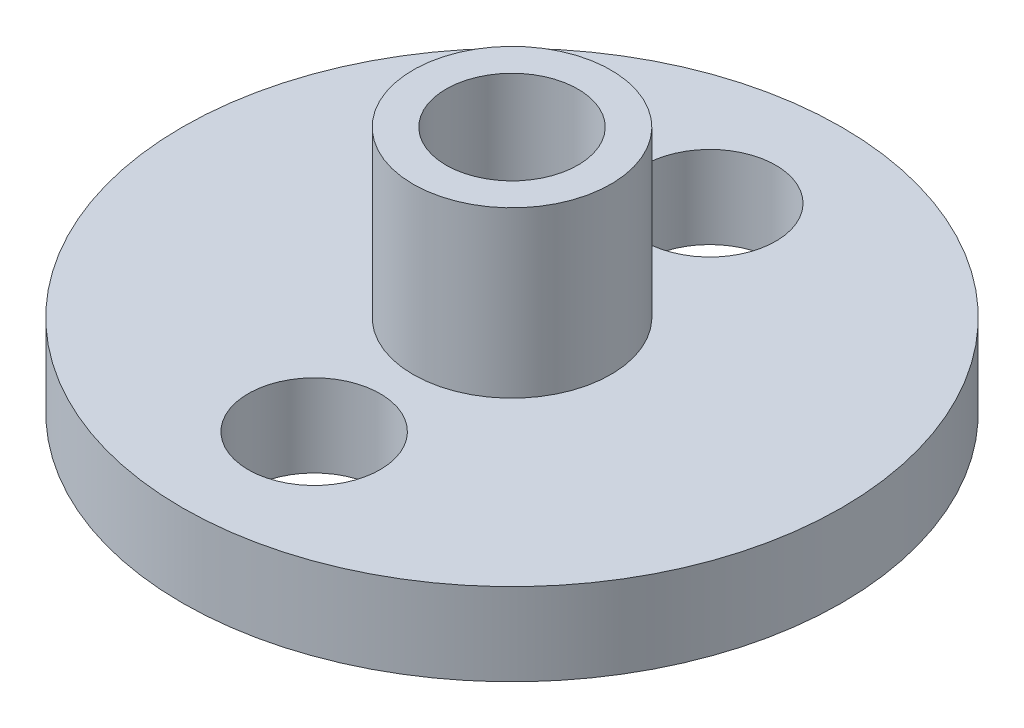
from build123d import *

# Parameters (mm, degrees)
SKETCH1_R           = 20
SKETCH1_R_2         = 4
BOSS_EXTRUDE1_DEPTH = 5
SKETCH2_R           = 6
SKETCH2_R_2         = 4
BOSS_EXTRUDE2_DEPTH = 10


with BuildPart() as part:
    # Sketch1 → Boss-Extrude1 (new body)
    with BuildSketch(Plane(origin=(0, 0, 0), x_dir=(1, 0, 0), z_dir=(0, 1, 0))):
        Circle(SKETCH1_R)
        with Locations((0, 12)):
            Circle(SKETCH1_R_2, mode=Mode.SUBTRACT)
        with Locations((0, -12)):
            Circle(SKETCH1_R_2, mode=Mode.SUBTRACT)
    extrude(amount=BOSS_EXTRUDE1_DEPTH)

    # Sketch2 → Boss-Extrude2 (add)
    with BuildSketch(Plane(origin=(0, 5, 0), x_dir=(1, 0, 0), z_dir=(0, 1, 0))):
        Circle(SKETCH2_R)
        Circle(SKETCH2_R_2, mode=Mode.SUBTRACT)
    extrude(amount=BOSS_EXTRUDE2_DEPTH)


solid = part.part
